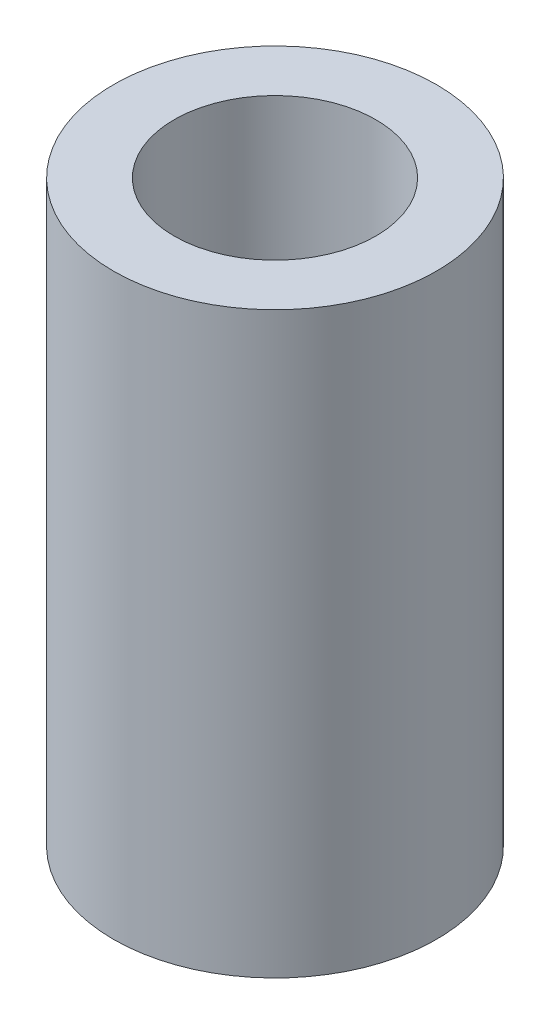
from build123d import *

# Parameters (mm, degrees)
SKETCH1_R           = 20
BOSS_EXTRUDE1_DEPTH = 71.654799574
SKETCH2_R           = 12.487491097
CUT_EXTRUDE1_DEPTH  = 78.03512382


with BuildPart() as part:
    # Sketch1 → Boss-Extrude1 (new body)
    with BuildSketch(Plane(origin=(0, 0, 0), x_dir=(1, 0, 0), z_dir=(0, 1, 0))):
        Circle(SKETCH1_R)
    extrude(amount=BOSS_EXTRUDE1_DEPTH)

    # Sketch2 → Cut-Extrude1 (cut, through all)
    with BuildSketch(Plane(origin=(0, 0, 0), x_dir=(1, 0, 0), z_dir=(0, 1, 0))):
        Circle(SKETCH2_R)
    extrude(amount=CUT_EXTRUDE1_DEPTH, mode=Mode.SUBTRACT)


solid = part.part
